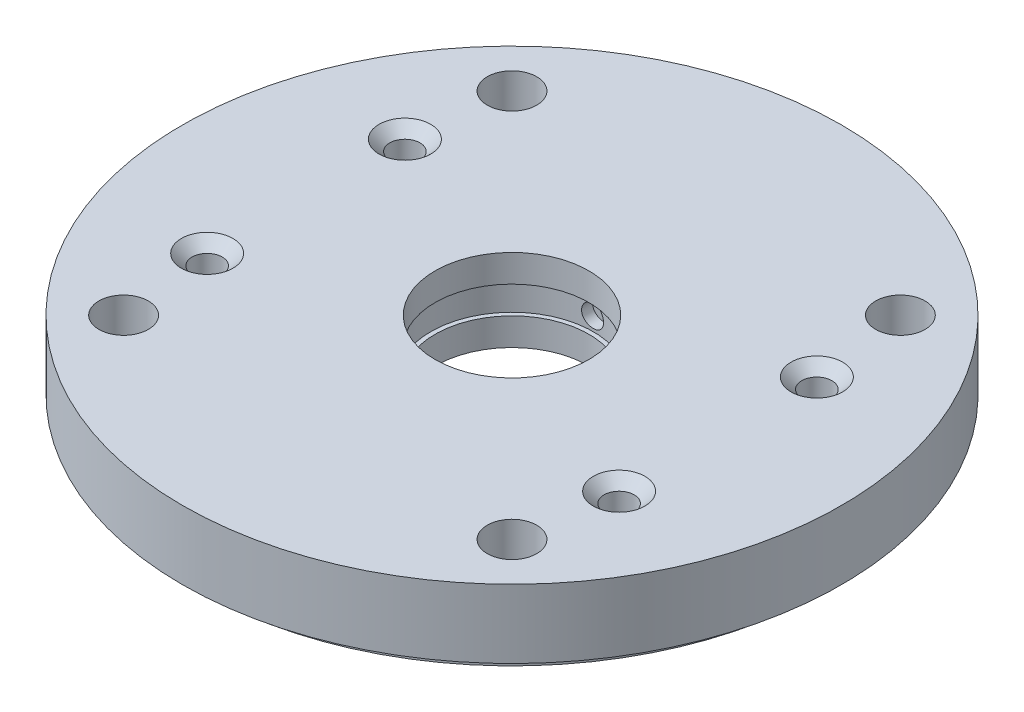
from build123d import *

# Parameters (mm, degrees)
SKETCH1_R                     = 57
EXTRUDE4_DEPTH                = 7.5
EXTRUDE5_DEPTH                = 7.5
EXTRUDE5_DEPTH_BACK           = 5
SKETCH_R                      = 60
SKETCH_R_2                    = 57
SKETCH2_R                     = 14
EXTRUDE6_DEPTH                = 87.168439698
SKETCH6_R                     = 14.8
EXTRUDE7_DEPTH                = 2.5
EXTRUDE8_START                = -16.8000001
EXTRUDE8_OUTLINE_R            = 2
EXTRUDE8_DEPTH                = 2.135757978
EXTRUDE8_START_2              = -3
EXTRUDE8_2_DEPTH              = 6
M8_CLEARANCE_HOLE1_D          = 9
CIRPATTERN1_COUNT             = 4
M5_CLEARANCE_HOLE1_AT_2_COUNT = 2
M5_CLEARANCE_HOLE1_AT_2_PITCH = 36
M5_CLEARANCE_HOLE1_AT_3_COUNT = 2
M5_CLEARANCE_HOLE1_AT_3_PITCH = 83.192547743
M5_CLEARANCE_HOLE1_AT_4_COUNT = 2
M5_CLEARANCE_HOLE1_AT_4_PITCH = 75


with BuildPart() as part:
    # Sketch1 → Extrude4 (new, symmetric)
    with BuildSketch(Plane(origin=(0, 0, 0), x_dir=(1, 0, 0), z_dir=(0, 1, 0))):
        with Locations(Location((0, 0, 0), (0, 0, 270))):
            Circle(SKETCH1_R)
    extrude(amount=EXTRUDE4_DEPTH, both=True)

    # Sketch → Extrude5 (add, two sides: drawn at the far end of the back side and taken through both)
    with BuildSketch(Plane(origin=(0, 0, 0), x_dir=(1, 0, 0), z_dir=(0, 1, 0)).offset(-EXTRUDE5_DEPTH_BACK)):
        with Locations(Location((0, 0, 0), (0, 0, 270))):
            Circle(SKETCH_R)
        with Locations(Location((0, 0, 0), (0, 0, 270))):
            Circle(SKETCH_R_2, mode=Mode.SUBTRACT)
    extrude(amount=EXTRUDE5_DEPTH + EXTRUDE5_DEPTH_BACK)

    # Sketch2 → Extrude6 (cut, through all)
    with BuildSketch(Plane(origin=(0, 7.5, 0), x_dir=(1, 0, 0), z_dir=(0, 1, 0))):
        with Locations(Location((0, 0, 0), (0, 0, 270))):
            Circle(SKETCH2_R)
    extrude(amount=-EXTRUDE6_DEPTH, mode=Mode.SUBTRACT)

    # Sketch6 → Extrude7 (cut, symmetric)
    with BuildSketch(Plane(origin=(0, 0, 0), x_dir=(1, 0, 0), z_dir=(0, 1, 0))):
        with Locations(Location((0, 0, 0), (0, 0, 270))):
            Circle(SKETCH6_R)
    extrude(amount=EXTRUDE7_DEPTH, both=True, mode=Mode.SUBTRACT)

    # Extrude8: read off the stored shape, not the designer's step
    # Extrude8 outline → Extrude8 (cut)
    with BuildSketch(Plane.XY.offset(EXTRUDE8_START)):
        Circle(EXTRUDE8_OUTLINE_R)
    extrude(amount=EXTRUDE8_DEPTH, mode=Mode.SUBTRACT)

    # Extrude8 2 outline → Extrude8 2 (add)
    with BuildSketch(Plane(origin=(0, 0, 0), x_dir=(1, 0, 0), z_dir=(0, 1, 0)).offset(EXTRUDE8_START_2)):
        with BuildLine():
            ThreePointArc((-2e-09, 16.8), (1.002059984, 16.770088723), (2.000551768, 16.680461403))
            Line((2.000551768, 16.680461403), (3, 16.56059374))
            Line((3, 16.56059374), (3, 16.8000001))
            Line((3, 16.8000001), (-2e-09, 16.8))
        make_face()
        with BuildLine():
            ThreePointArc((-2.000001192, 16.680527427), (-1.001783219, 16.770105259), (-2e-09, 16.8))
            Line((-2e-09, 16.8), (-3, 16.8000001))
            Line((-3, 16.8000001), (-3, 16.560627213))
            Line((-3, 16.560627213), (-2.000001192, 16.680527427))
        make_face()
    extrude(amount=EXTRUDE8_2_DEPTH)

    # M8 Clearance Hole1 (through all)
    with Locations(Plane(origin=(0, 7.5, 0), x_dir=(1, 0, 0), z_dir=(0, 1, 0))):
        with Locations((-35.355339059, -35.355339059)):
            m8_clearance_hole1 = Hole(M8_CLEARANCE_HOLE1_D / 2)

    # CirPattern1: M8 Clearance Hole1 ×4 about axis
    cirpattern1_axis = Axis((0, 0, 0), (0, 1, 0))
    for i in range(1, CIRPATTERN1_COUNT):
        add(m8_clearance_hole1.rotate(cirpattern1_axis, i * 360 / CIRPATTERN1_COUNT), mode=Mode.SUBTRACT)

    # Sketch10 → M5 Clearance Hole1 (revolve, cut)
    with BuildSketch(Plane(origin=(37.5, -7.5, 18), x_dir=(0, 0, -1), z_dir=(1, 0, 0))):
        Polygon((0, 0), (0, 15), (4.7, 15), (2.75, 13.05), (2.75, 0), align=None)
    m5_clearance_hole1 = revolve(axis=Axis((37.5, -13.85, 18), (0, 1, 0)), mode=Mode.SUBTRACT)

    # M5 Clearance Hole1 at 2: M5 Clearance Hole1 ×2
    with Locations(*[(0, 0, -i * M5_CLEARANCE_HOLE1_AT_2_PITCH) for i in range(1, M5_CLEARANCE_HOLE1_AT_2_COUNT)]):
        add(m5_clearance_hole1, mode=Mode.SUBTRACT)

    # M5 Clearance Hole1 at 3: M5 Clearance Hole1 ×2
    with Locations(*[Vector(-0.9015230574682735, 0, -0.4327310675847715) * (i * M5_CLEARANCE_HOLE1_AT_3_PITCH) for i in range(1, M5_CLEARANCE_HOLE1_AT_3_COUNT)]):
        add(m5_clearance_hole1, mode=Mode.SUBTRACT)

    # M5 Clearance Hole1 at 4: M5 Clearance Hole1 ×2
    with Locations(*[(-i * M5_CLEARANCE_HOLE1_AT_4_PITCH, 0, 0) for i in range(1, M5_CLEARANCE_HOLE1_AT_4_COUNT)]):
        add(m5_clearance_hole1, mode=Mode.SUBTRACT)


solid = part.part
